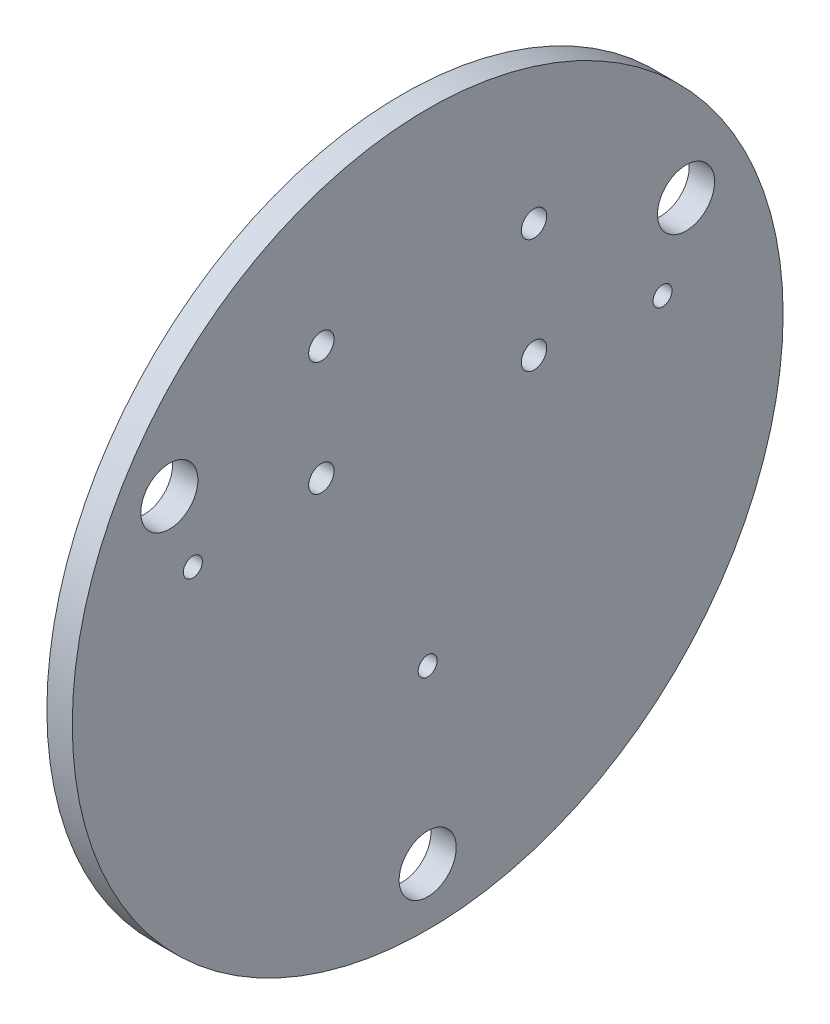
from build123d import *

# Parameters (mm, degrees)
SKETCH1_R           = 56
BOSS_EXTRUDE1_DEPTH = 4
SKETCH2_R           = 4.5
CUT_EXTRUDE1_DEPTH  = 80.296910406
SKETCH4_R           = 2
SKETCH4_R_2         = 1.5
CUT_EXTRUDE3_DEPTH  = 80.296910406


with BuildPart() as part:
    # Sketch1 → Boss-Extrude1 (new body)
    with BuildSketch(Plane(origin=(0, 0, 0), x_dir=(0, 0, -1), z_dir=(1, 0, 0))):
        Circle(SKETCH1_R)
    extrude(amount=BOSS_EXTRUDE1_DEPTH)

    # Sketch2 → Cut-Extrude1 (cut, through all)
    with BuildSketch(Plane.ZY):
        with Locations((-40.703193978, 23.5)):
            Circle(SKETCH2_R)
        with Locations((40.703193978, 23.5)):
            Circle(SKETCH2_R)
        with Locations((0, -47)):
            Circle(SKETCH2_R)
    extrude(amount=-CUT_EXTRUDE1_DEPTH, mode=Mode.SUBTRACT)

    # Sketch4 → Cut-Extrude3 (cut, through all)
    with BuildSketch(Plane(origin=(4, 0, 0), x_dir=(0, 0, -1), z_dir=(1, 0, 0))):
        with Locations((-16.75, 31.995494219)):
            Circle(SKETCH4_R)
        with Locations((16.75, 31.995494219)):
            Circle(SKETCH4_R)
        with Locations((16.75, 14)):
            Circle(SKETCH4_R)
        with Locations((-16.75, 14)):
            Circle(SKETCH4_R)
        with Locations((-37, 12)):
            Circle(SKETCH4_R_2)
        with Locations((0, -20)):
            Circle(SKETCH4_R_2)
        with Locations((37, 12)):
            Circle(SKETCH4_R_2)
    extrude(amount=-CUT_EXTRUDE3_DEPTH, mode=Mode.SUBTRACT)


solid = part.part
